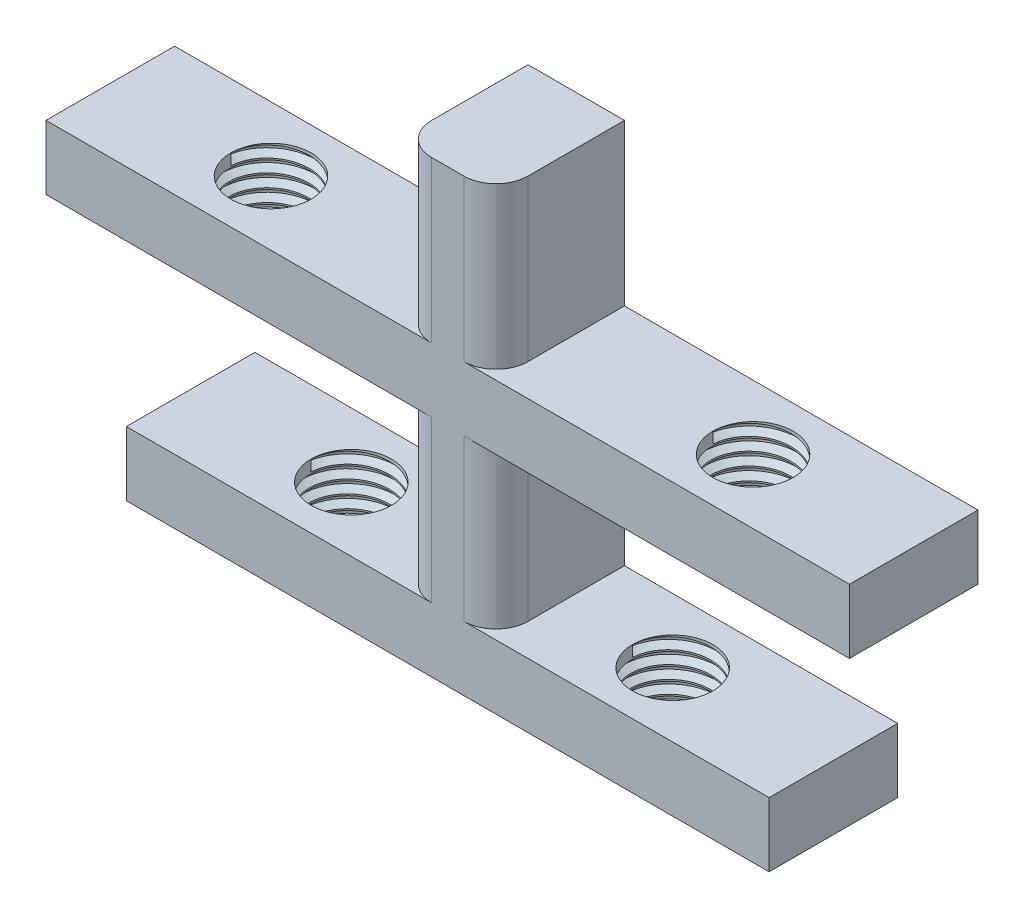
from build123d import *

# Parameters (mm, degrees)
SKETCH1_W           = 200
SKETCH1_H           = 40
SKETCH1_R           = 12.5
BOSS_EXTRUDE1_DEPTH = 20
SKETCH2_W           = 30
SKETCH2_H           = 40
BOSS_EXTRUDE2_DEPTH = 50
FILLET1_R           = 10
THREAD1_PITCH       = 4
THREAD2_PITCH       = 4
SKETCH8_R           = 12.5
BOSS_EXTRUDE4_DEPTH = 20
SKETCH9_W           = 30
SKETCH9_H           = 40
BOSS_EXTRUDE5_DEPTH = 50
FILLET2_R           = 10
THREAD3_PITCH       = 4
THREAD4_PITCH       = 4


with BuildPart() as part:
    # Sketch1 → Boss-Extrude1 (new body)
    with BuildSketch(Plane(origin=(0, 0, 0), x_dir=(1, 0, 0), z_dir=(0, 1, 0))):
        Rectangle(SKETCH1_W, SKETCH1_H)
        with Locations(Location((-50, 0, 0), (0, 0, 270))):
            Circle(SKETCH1_R, mode=Mode.SUBTRACT)
        with Locations(Location((50, 0, 0), (0, 0, 90))):
            Circle(SKETCH1_R, mode=Mode.SUBTRACT)
    extrude(amount=BOSS_EXTRUDE1_DEPTH)

    # Sketch2 → Boss-Extrude2 (add)
    with BuildSketch(Plane(origin=(0, 20, 0), x_dir=(1, 0, 0), z_dir=(0, 1, 0))):
        Rectangle(SKETCH2_W, SKETCH2_H)
    extrude(amount=BOSS_EXTRUDE2_DEPTH)

    # Fillet1
    fillet1_edges = [part.edges().sort_by_distance(p)[0] for p in [
        (15, 45, 20),
        (-15, 45, 20),
    ]]
    fillet(fillet1_edges, radius=FILLET1_R)

    # Thread1: the profile of Thread Profile1 profile screwed along a right-hand helix of 5 turns, 12 arcs to a turn; built about Z, then put on its axis
    thread1_z = Axis((0, 0, 0), (0, 0, 1))
    thread1_corners = [(12.4997, 0, -0.000173205), (12.4997, 0, 3.500173194), (14.6650635, 0, 2.249999995), (14.6650635, 0, 1.249999995)]
    with BuildLine(mode=Mode.PRIVATE) as thread1_profile:
        Line(thread1_corners[0], thread1_corners[1])
        Line(thread1_corners[1], thread1_corners[2])
        Line(thread1_corners[2], thread1_corners[3])
        Line(thread1_corners[3], thread1_corners[0])
    thread1_cap = Face(thread1_profile.wire())
    thread1_turn_angles = [0, 15, 30, 45, 60, 75, 90, 105, 120, 135, 150, 165, 180, 195, 210, 225, 240, 255, 270, 285, 300, 315, 330, 345, 360]
    thread1_turn_weights = [1, 0.9659258262890683, 1, 0.9659258262890683, 1, 0.9659258262890683, 1, 0.9659258262890683, 1, 0.9659258262890683, 1, 0.9659258262890683, 1, 0.9659258262890683, 1, 0.9659258262890683, 1, 0.9659258262890683, 1, 0.9659258262890683, 1, 0.9659258262890683, 1, 0.9659258262890683, 1]
    thread1_turn_rails = [Edge.make_bspline([Vector(p[0], p[1], 0).rotate(thread1_z, thread1_turn_angles[k]) / thread1_turn_weights[k] + Vector(0, 0, p[2] + THREAD1_PITCH * thread1_turn_angles[k] / 360) for k in range(25)], [0, 0, 0, 1, 1, 2, 2, 3, 3, 4, 4, 5, 5, 6, 6, 7, 7, 8, 8, 9, 9, 10, 10, 11, 11, 12, 12, 12], 2, thread1_turn_weights) for p in thread1_corners]
    thread1_turn_sides = [Face.make_surface_from_curves(thread1_turn_rails[p[0]], thread1_turn_rails[p[1]]) for p in [(0, 1), (1, 2), (2, 3), (3, 0)]]
    thread1 = Plane(origin=(-50, 20, 0), x_dir=(-1, 0, 0), z_dir=(0, -1, 0)) * Solid(Shell([*[p.moved(Location((0, 0, THREAD1_PITCH * i))) for i in range(5) for p in thread1_turn_sides], thread1_cap, thread1_cap.rotate(thread1_z, 1800).moved(Location((0, 0, THREAD1_PITCH * 1800 / 360)))]))
    add(thread1, mode=Mode.SUBTRACT)

    # Thread2: the profile of Thread Profile2 profile screwed along a right-hand helix of 5 turns, 12 arcs to a turn; built about Z, then put on its axis
    thread2_z = Axis((0, 0, 0), (0, 0, 1))
    thread2_corners = [(12.4997, 0, -0.000173205), (12.4997, 0, 3.500173194), (14.6650635, 0, 2.249999995), (14.6650635, 0, 1.249999995)]
    with BuildLine(mode=Mode.PRIVATE) as thread2_profile:
        Line(thread2_corners[0], thread2_corners[1])
        Line(thread2_corners[1], thread2_corners[2])
        Line(thread2_corners[2], thread2_corners[3])
        Line(thread2_corners[3], thread2_corners[0])
    thread2_cap = Face(thread2_profile.wire())
    thread2_turn_angles = [0, 15, 30, 45, 60, 75, 90, 105, 120, 135, 150, 165, 180, 195, 210, 225, 240, 255, 270, 285, 300, 315, 330, 345, 360]
    thread2_turn_weights = [1, 0.9659258262890683, 1, 0.9659258262890683, 1, 0.9659258262890683, 1, 0.9659258262890683, 1, 0.9659258262890683, 1, 0.9659258262890683, 1, 0.9659258262890683, 1, 0.9659258262890683, 1, 0.9659258262890683, 1, 0.9659258262890683, 1, 0.9659258262890683, 1, 0.9659258262890683, 1]
    thread2_turn_rails = [Edge.make_bspline([Vector(p[0], p[1], 0).rotate(thread2_z, thread2_turn_angles[k]) / thread2_turn_weights[k] + Vector(0, 0, p[2] + THREAD2_PITCH * thread2_turn_angles[k] / 360) for k in range(25)], [0, 0, 0, 1, 1, 2, 2, 3, 3, 4, 4, 5, 5, 6, 6, 7, 7, 8, 8, 9, 9, 10, 10, 11, 11, 12, 12, 12], 2, thread2_turn_weights) for p in thread2_corners]
    thread2_turn_sides = [Face.make_surface_from_curves(thread2_turn_rails[p[0]], thread2_turn_rails[p[1]]) for p in [(0, 1), (1, 2), (2, 3), (3, 0)]]
    thread2 = Plane(origin=(50, 20, 0), x_dir=(-1, 0, 0), z_dir=(0, -1, 0)) * Solid(Shell([*[p.moved(Location((0, 0, THREAD2_PITCH * i))) for i in range(5) for p in thread2_turn_sides], thread2_cap, thread2_cap.rotate(thread2_z, 1800).moved(Location((0, 0, THREAD2_PITCH * 1800 / 360)))]))
    add(thread2, mode=Mode.SUBTRACT)

    # Sketch8 → Boss-Extrude4 (add)
    with BuildSketch(Plane(origin=(0, 70, 0), x_dir=(1, 0, 0), z_dir=(0, 1, 0))):
        Polygon((-125, 20), (100, 20), (125, 20), (125, -20), (100, -20), (-125, -20), align=None)
        with Locations(Location((-75, 0, 0), (0, 0, 270))):
            Circle(SKETCH8_R, mode=Mode.SUBTRACT)
        with Locations(Location((75, 0, 0), (0, 0, 90))):
            Circle(SKETCH8_R, mode=Mode.SUBTRACT)
    extrude(amount=BOSS_EXTRUDE4_DEPTH)

    # Sketch9 → Boss-Extrude5 (add)
    with BuildSketch(Plane(origin=(0, 90, 0), x_dir=(1, 0, 0), z_dir=(0, 1, 0))):
        Rectangle(SKETCH9_W, SKETCH9_H)
    extrude(amount=BOSS_EXTRUDE5_DEPTH)

    # Fillet2
    fillet2_edges = [part.edges().sort_by_distance(p)[0] for p in [
        (15, 115, 20),
        (-15, 115, 20),
    ]]
    fillet(fillet2_edges, radius=FILLET2_R)

    # Thread3: the profile of Thread Profile3 profile screwed along a right-hand helix of 5 turns, 12 arcs to a turn; built about Z, then put on its axis
    thread3_z = Axis((0, 0, 0), (0, 0, 1))
    thread3_corners = [(12.4997, 0, -0.000173205), (12.4997, 0, 3.500173194), (14.6650635, 0, 2.249999995), (14.6650635, 0, 1.249999995)]
    with BuildLine(mode=Mode.PRIVATE) as thread3_profile:
        Line(thread3_corners[0], thread3_corners[1])
        Line(thread3_corners[1], thread3_corners[2])
        Line(thread3_corners[2], thread3_corners[3])
        Line(thread3_corners[3], thread3_corners[0])
    thread3_cap = Face(thread3_profile.wire())
    thread3_turn_angles = [0, 15, 30, 45, 60, 75, 90, 105, 120, 135, 150, 165, 180, 195, 210, 225, 240, 255, 270, 285, 300, 315, 330, 345, 360]
    thread3_turn_weights = [1, 0.9659258262890683, 1, 0.9659258262890683, 1, 0.9659258262890683, 1, 0.9659258262890683, 1, 0.9659258262890683, 1, 0.9659258262890683, 1, 0.9659258262890683, 1, 0.9659258262890683, 1, 0.9659258262890683, 1, 0.9659258262890683, 1, 0.9659258262890683, 1, 0.9659258262890683, 1]
    thread3_turn_rails = [Edge.make_bspline([Vector(p[0], p[1], 0).rotate(thread3_z, thread3_turn_angles[k]) / thread3_turn_weights[k] + Vector(0, 0, p[2] + THREAD3_PITCH * thread3_turn_angles[k] / 360) for k in range(25)], [0, 0, 0, 1, 1, 2, 2, 3, 3, 4, 4, 5, 5, 6, 6, 7, 7, 8, 8, 9, 9, 10, 10, 11, 11, 12, 12, 12], 2, thread3_turn_weights) for p in thread3_corners]
    thread3_turn_sides = [Face.make_surface_from_curves(thread3_turn_rails[p[0]], thread3_turn_rails[p[1]]) for p in [(0, 1), (1, 2), (2, 3), (3, 0)]]
    thread3 = Plane(origin=(-75, 90, 0), x_dir=(-1, 0, 0), z_dir=(0, -1, 0)) * Solid(Shell([*[p.moved(Location((0, 0, THREAD3_PITCH * i))) for i in range(5) for p in thread3_turn_sides], thread3_cap, thread3_cap.rotate(thread3_z, 1800).moved(Location((0, 0, THREAD3_PITCH * 1800 / 360)))]))
    add(thread3, mode=Mode.SUBTRACT)

    # Thread4: the profile of Thread Profile4 profile screwed along a right-hand helix of 5 turns, 12 arcs to a turn; built about Z, then put on its axis
    thread4_z = Axis((0, 0, 0), (0, 0, 1))
    thread4_corners = [(12.4997, 0, -0.000173205), (12.4997, 0, 3.500173194), (14.6650635, 0, 2.249999995), (14.6650635, 0, 1.249999995)]
    with BuildLine(mode=Mode.PRIVATE) as thread4_profile:
        Line(thread4_corners[0], thread4_corners[1])
        Line(thread4_corners[1], thread4_corners[2])
        Line(thread4_corners[2], thread4_corners[3])
        Line(thread4_corners[3], thread4_corners[0])
    thread4_cap = Face(thread4_profile.wire())
    thread4_turn_angles = [0, 15, 30, 45, 60, 75, 90, 105, 120, 135, 150, 165, 180, 195, 210, 225, 240, 255, 270, 285, 300, 315, 330, 345, 360]
    thread4_turn_weights = [1, 0.9659258262890683, 1, 0.9659258262890683, 1, 0.9659258262890683, 1, 0.9659258262890683, 1, 0.9659258262890683, 1, 0.9659258262890683, 1, 0.9659258262890683, 1, 0.9659258262890683, 1, 0.9659258262890683, 1, 0.9659258262890683, 1, 0.9659258262890683, 1, 0.9659258262890683, 1]
    thread4_turn_rails = [Edge.make_bspline([Vector(p[0], p[1], 0).rotate(thread4_z, thread4_turn_angles[k]) / thread4_turn_weights[k] + Vector(0, 0, p[2] + THREAD4_PITCH * thread4_turn_angles[k] / 360) for k in range(25)], [0, 0, 0, 1, 1, 2, 2, 3, 3, 4, 4, 5, 5, 6, 6, 7, 7, 8, 8, 9, 9, 10, 10, 11, 11, 12, 12, 12], 2, thread4_turn_weights) for p in thread4_corners]
    thread4_turn_sides = [Face.make_surface_from_curves(thread4_turn_rails[p[0]], thread4_turn_rails[p[1]]) for p in [(0, 1), (1, 2), (2, 3), (3, 0)]]
    thread4 = Plane(origin=(75, 90, 0), x_dir=(-1, 0, 0), z_dir=(0, -1, 0)) * Solid(Shell([*[p.moved(Location((0, 0, THREAD4_PITCH * i))) for i in range(5) for p in thread4_turn_sides], thread4_cap, thread4_cap.rotate(thread4_z, 1800).moved(Location((0, 0, THREAD4_PITCH * 1800 / 360)))]))
    add(thread4, mode=Mode.SUBTRACT)


solid = part.part
